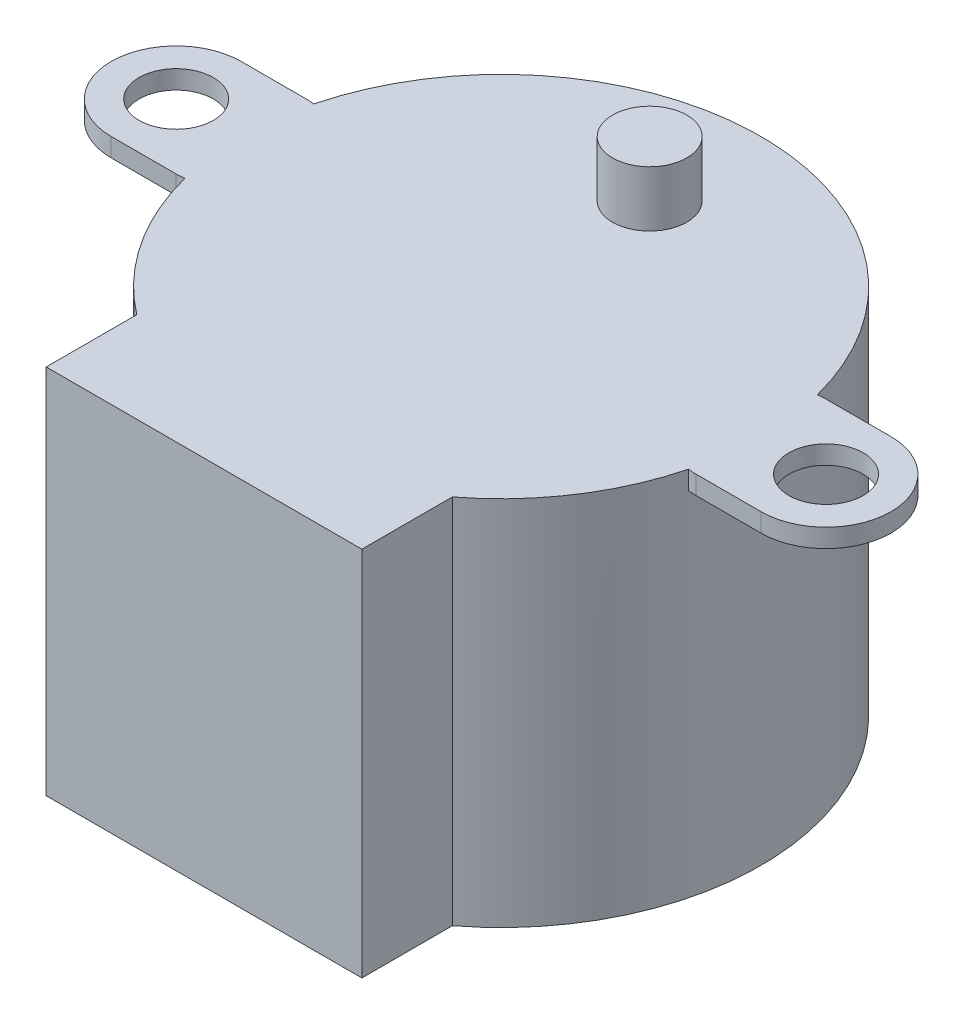
from build123d import *

# Parameters (mm, degrees)
BOSS_EXTRUDE1_DEPTH = 20
SKETCH2_R           = 2
BOSS_EXTRUDE2_DEPTH = 1
SKETCH3_R           = 2
BOSS_EXTRUDE3_DEPTH = 3


with BuildPart() as part:
    # Sketch1 → Boss-Extrude1 (new body)
    with BuildSketch(Plane(origin=(0, 0, 0), x_dir=(1, 0, 0), z_dir=(0, 1, 0))):
        with BuildLine():
            Line((-8.5, -11.124297731), (-8.5, -16))
            Line((-8.5, -16), (8.5, -16))
            Line((8.5, -16), (8.5, -11.124297731))
            ThreePointArc((8.5, -11.124297731), (0, 14), (-8.5, -11.124297731))
        make_face()
    extrude(amount=BOSS_EXTRUDE1_DEPTH)

    # Sketch2 → Boss-Extrude2 (add)
    # profile 1 of 2: a face of its own
    with BuildSketch(Plane(origin=(0, 20, 0), x_dir=(1, 0, 0), z_dir=(0, 1, 0))):
        with BuildLine():
            Line((14, 3.5), (17.5, 3.5))
            ThreePointArc((17.5, 3.5), (21, 0), (17.5, -3.5))
            Line((17.5, -3.5), (14, -3.5))
            ThreePointArc((14, -3.5), (10.5, 0), (14, 3.5))
        make_face()
        with Locations((17.5, 0)):
            Circle(SKETCH2_R, mode=Mode.SUBTRACT)
    # profile 2 of 2: a face of its own
    with BuildSketch(Plane(origin=(0, 20, 0), x_dir=(1, 0, 0), z_dir=(0, 1, 0))):
        with BuildLine():
            Line((-14, 3.5), (-17.5, 3.5))
            ThreePointArc((-17.5, 3.5), (-21, 0), (-17.5, -3.5))
            Line((-17.5, -3.5), (-14, -3.5))
            ThreePointArc((-14, -3.5), (-10.5, 0), (-14, 3.5))
        make_face()
        with Locations((-17.5, 0)):
            Circle(SKETCH2_R, mode=Mode.SUBTRACT)
    extrude(amount=-BOSS_EXTRUDE2_DEPTH)

    # Sketch3 → Boss-Extrude3 (add)
    with BuildSketch(Plane(origin=(0, 20, 0), x_dir=(1, 0, 0), z_dir=(0, 1, 0))):
        with Locations((0, 8)):
            Circle(SKETCH3_R)
    extrude(amount=BOSS_EXTRUDE3_DEPTH)


solid = part.part
